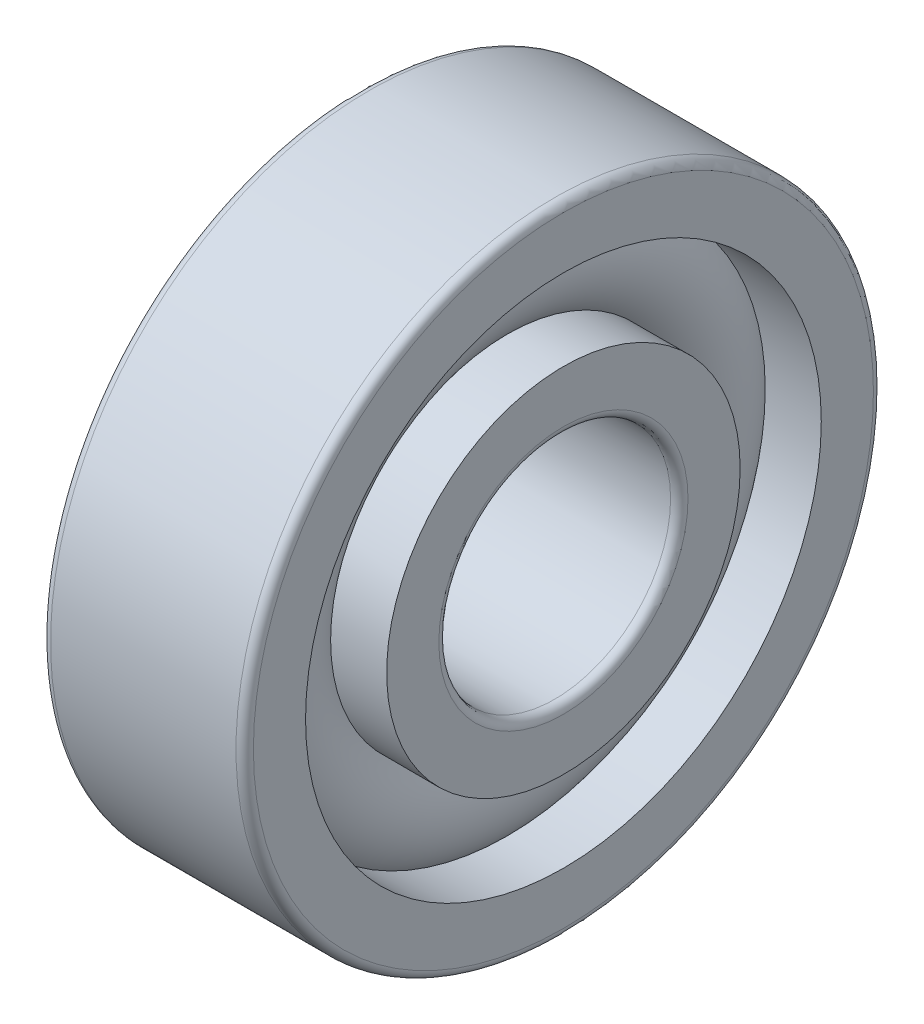
from build123d import *

# Parameters (mm, degrees)
CAGSPISKE_W     = 0.42
CAGSPISKE_H     = 0.7
CAGESPINE_ANGLE = 0.001
BALSIMSKE_R     = 2.1


with BuildPart() as part:
    # CagSpiSke → CageSpine (revolve)
    with BuildSketch(Plane.XY):
        with Locations((0, 7.5)):
            Rectangle(CAGSPISKE_W, CAGSPISKE_H)
    revolve(axis=Axis((-20.6375, 0, 0), (-1, 0, 0)), revolution_arc=CAGESPINE_ANGLE)

    # BalSimSke → BallsSimplified (revolve)
    with BuildSketch(Plane.XY):
        with Locations((0, 7.5)):
            Circle(BALSIMSKE_R)
    revolve(axis=Axis((-10, 0, 0), (1, 0, 0)))

    # InnRacSke → InnerRace (revolve)
    with BuildSketch(Plane.XY):
        with BuildLine():
            Line((-1.531543339, 6.1), (-3.5, 6.1))
            Line((-3.5, 6.1), (-3.5, 4.3))
            ThreePointArc((-3.5, 4.3), (-3.412132034, 4.087867966), (-3.2, 4))
            Line((-3.2, 4), (3.2, 4))
            ThreePointArc((3.2, 4), (3.412132034, 4.087867966), (3.5, 4.3))
            Line((3.5, 4.3), (3.5, 6.1))
            Line((3.5, 6.1), (1.531543339, 6.1))
            ThreePointArc((1.531543339, 6.1), (0, 5.425), (-1.531543339, 6.1))
        make_face()
    revolve(axis=Axis((-20.6375, 0, 0), (1, 0, 0)))

    # OutRacSke → OuterRace (revolve)
    with BuildSketch(Plane.XY):
        with BuildLine():
            Line((-1.531543339, 8.9), (-3.5, 8.9))
            Line((-3.5, 8.9), (-3.5, 10.7))
            ThreePointArc((-3.5, 10.7), (-3.412132034, 10.912132034), (-3.2, 11))
            Line((-3.2, 11), (3.2, 11))
            ThreePointArc((3.2, 11), (3.412132034, 10.912132034), (3.5, 10.7))
            Line((3.5, 10.7), (3.5, 8.9))
            Line((3.5, 8.9), (1.531543339, 8.9))
            ThreePointArc((1.531543339, 8.9), (0, 9.575), (-1.531543339, 8.9))
        make_face()
    revolve(axis=Axis((-20.6375, 0, 0), (1, 0, 0)))


solid = part.part
